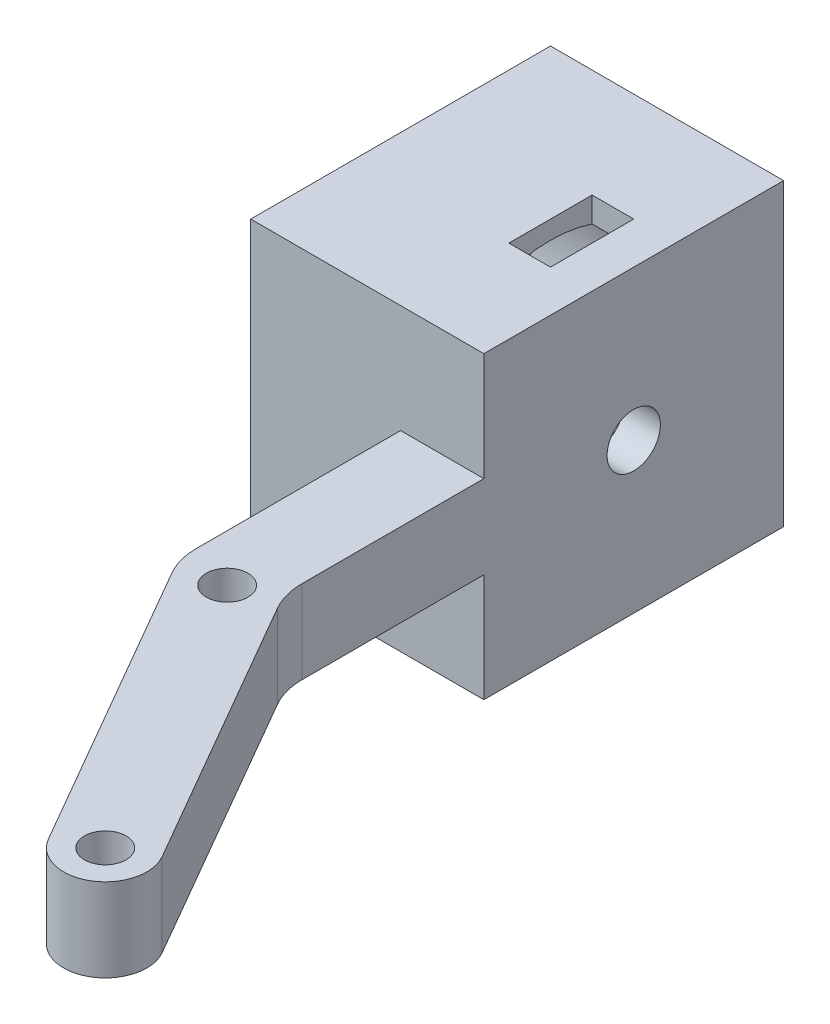
from build123d import *

# Parameters (mm, degrees)
SKETCH1_R               = 1.5875
BOSS_EXTRUDE1_DEPTH     = 22.86
TOP_CUT_DEPTH           = 8.255
BOTTOM_CUT_DEPTH        = 8.255
SKETCH5_R               = 10.033
CUT_EXTRUDE1_DEPTH      = 14.986
SKETCH7_R               = 2.032
CUT_EXTRUDE2_DEPTH      = 49.946539324
CUT_EXTRUDE3_REACH      = 50.947
CUT_EXTRUDE3_END_RADIUS = 10.033
SKETCH8_W               = 3.175
SKETCH8_H               = 6.35
FILLET1_R               = 5.08


with BuildPart() as part:
    # Sketch1 → Boss-Extrude1 (new body)
    with BuildSketch(Plane(origin=(0, 0, 0), x_dir=(1, 0, 0), z_dir=(0, 1, 0))):
        with BuildLine():
            Line((-6.35, -14.401477372), (-6.35, 2.54))
            Line((-6.35, 2.54), (-17.78, 2.54))
            Line((-17.78, 2.54), (-17.78, 25.4))
            Line((-17.78, 25.4), (0, 25.4))
            Line((0, 25.4), (0, -12.7))
            Line((0, -12.7), (12.7, -34.697045256))
            ThreePointArc((12.7, -34.697045256), (11.537869343, -39.034175913), (7.200738686, -37.872045256))
            Line((7.200738686, -37.872045256), (-6.35, -14.401477372))
        make_face()
        with Locations((9.950369343, -36.284545256)):
            Circle(SKETCH1_R, mode=Mode.SUBTRACT)
        with Locations((-2.749630657, -14.2875)):
            Circle(SKETCH1_R, mode=Mode.SUBTRACT)
    extrude(amount=BOSS_EXTRUDE1_DEPTH)

    # Sketch2 → Top Cut (cut)
    with BuildSketch(Plane(origin=(0, 22.86, 0), x_dir=(1, 0, 0), z_dir=(0, 1, 0))):
        Polygon((-6.35, -14.401477372), (8.788238686, -40.621675913), (14.2875, -37.446675913), (0, -12.7), (0, 2.54), (-6.35, 2.54), align=None)
    extrude(amount=-TOP_CUT_DEPTH, mode=Mode.SUBTRACT)

    # Sketch4 → Bottom Cut (cut)
    with BuildSketch(Plane.XZ):
        Polygon((-6.35, -2.54), (-6.35, 14.401477372), (8.788238686, 40.621675913), (14.2875, 37.446675913), (0, 12.7), (0, -2.54), align=None)
    extrude(amount=-BOTTOM_CUT_DEPTH, mode=Mode.SUBTRACT)

    # Sketch5 → Cut-Extrude1 (cut)
    with BuildSketch(Plane.ZY.offset(17.78)):
        with Locations((-13.97, 11.43)):
            Circle(SKETCH5_R)
    extrude(amount=-CUT_EXTRUDE1_DEPTH, mode=Mode.SUBTRACT)

    # Sketch7 → Cut-Extrude2 (cut, through all)
    with BuildSketch(Plane(origin=(0, 0, 0), x_dir=(0, 0, -1), z_dir=(1, 0, 0))):
        with Locations((13.97, 11.43)):
            Circle(SKETCH7_R)
    extrude(amount=-CUT_EXTRUDE2_DEPTH, mode=Mode.SUBTRACT)

    # Cut-Extrude3: up to this cylinder (the profile starts outside it)
    cut_extrude3_end = Plane(origin=(-4.7625, 11.43, -13.97), z_dir=(-1, 0, 0)) * Cylinder(CUT_EXTRUDE3_END_RADIUS, 122.96, mode=Mode.PRIVATE)
    # Sketch8 → Cut-Extrude3 (cut, up to the surface)
    with BuildSketch(Plane(origin=(0, 22.86, 0), x_dir=(1, 0, 0), z_dir=(0, 1, 0)), mode=Mode.PRIVATE) as cut_extrude3_sk1:
        with Locations((-4.7625, 13.97)):
            Rectangle(SKETCH8_W, SKETCH8_H)
    cut_extrude3_tool1 = extrude(cut_extrude3_sk1.sketch, amount=-CUT_EXTRUDE3_REACH, mode=Mode.PRIVATE) - cut_extrude3_end
    add(cut_extrude3_tool1.solids().sort_by_distance((-4.7625, 22.86, -13.97))[0], mode=Mode.SUBTRACT)

    # Fillet1
    fillet1_edges = [part.edges().sort_by_distance(p)[0] for p in [
        (0, 11.43, 12.7),
        (-6.35, 11.43, 14.401477372),
    ]]
    fillet(fillet1_edges, radius=FILLET1_R)


solid = part.part
